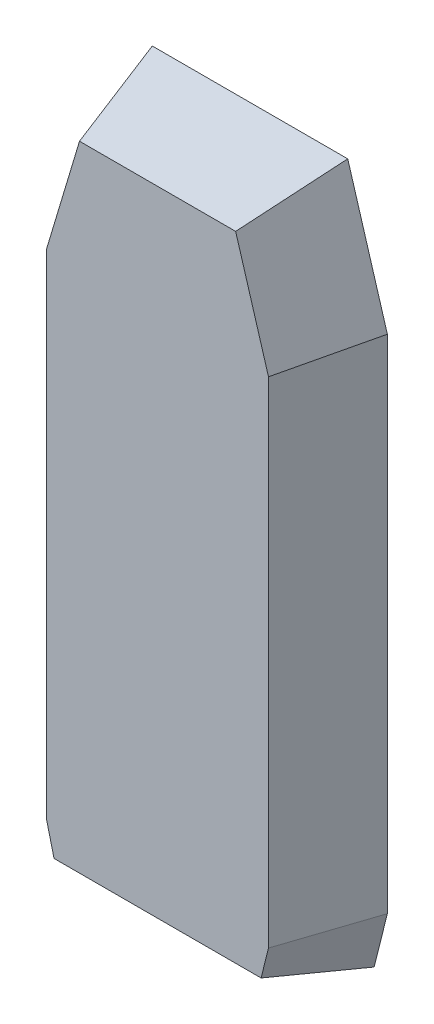
from build123d import *

# Parameters (mm, degrees)
LOFT2_DEPTH = 35
LOFT2_DRAFT = 15.9453959
SHELL1_T    = -3


# Read off the part's stored shape, not the designer's step: Loft2
with BuildPart() as part:
    # Loft2 outline → Loft2 (with draft: the straight prism first)
    with BuildSketch(Plane.XY.offset(70)):
        Polygon((39.192235936, -105), (42, -93.768943744), (42, 93.532311637), (29.559693491, 135), (-29.559693491, 135), (-42, 93.532311637), (-42, -93.768943744), (-39.192235936, -105), align=None)
    extrude(amount=-LOFT2_DEPTH)
    # Loft2: the draft: its side faces are tilted about the plane it starts from
    loft2_sides = [part.faces().sort_by_distance(p)[0] for p in [
        (40.596117968, -99.384471872, 52.5),
        (42, -0.118316053, 52.5),
        (35.779846746, 114.266155819, 52.5),
        (0, 135, 52.5),
        (-35.779846746, 114.266155818, 52.5),
        (-42, -0.118316053, 52.5),
        (-40.596117968, -99.384471872, 52.5),
        (0, -105, 52.5),
    ]]
    draft(loft2_sides, Plane.XY.offset(70), LOFT2_DRAFT)

    # Shell1
    shell1_openings = [part.faces().sort_by_distance(p)[0] for p in [
        (0, 12.225404098, 35),
    ]]
    offset(amount=SHELL1_T, openings=shell1_openings, kind=Kind.INTERSECTION)


solid = part.part
